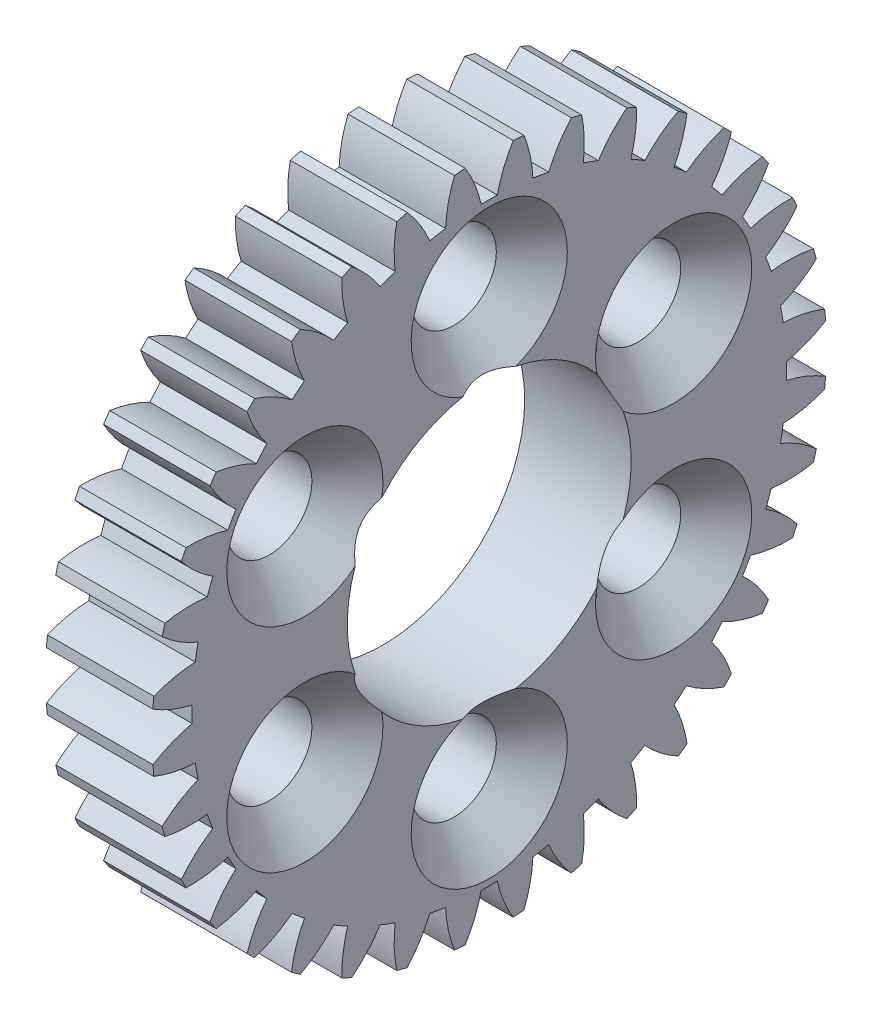
from build123d import *

# Parameters (mm, degrees)
BASPROSKE_W           = 3
BASPROSKE_H           = 9.5
TOOTHCUT_DEPTH        = 14.765899898
TEETHCUTS_COUNT       = 36
TEETHCUTS_ANGLE       = 350
BORSKE_R              = 4
BORE_DEPTH            = 50.0000508
PADR_OCIRCULAR1_COUNT = 6


with BuildPart() as part:
    # BasProSke → Base-Revolve (revolve)
    with BuildSketch(Plane(origin=(0, 0, 0), x_dir=(1, 0, 0), z_dir=(0, 1, 0))):
        with Locations((1.5, 4.75)):
            Rectangle(BASPROSKE_W, BASPROSKE_H)
    revolve(axis=Axis((-10, 0, 0), (1, 0, 0)))

    # TooCutSke → ToothCut (cut, through all)
    with BuildSketch(Plane(origin=(0, 0, 0), x_dir=(0, 0, -1), z_dir=(1, 0, 0))):
        with BuildLine():
            ThreePointArc((0.227221176, 8.370916708), (0, 8.374), (-0.227221176, 8.370916708))
            ThreePointArc((-0.227221176, 8.370916708), (-0.411410437, 8.955426484), (-0.69207336, 9.500225241))
            ThreePointArc((-0.69207336, 9.500225241), (0, 9.5254), (0.69207336, 9.500225241))
            ThreePointArc((0.69207336, 9.500225241), (0.411410437, 8.955426484), (0.227221176, 8.370916708))
        make_face()
    toothcut = extrude(amount=TOOTHCUT_DEPTH, mode=Mode.SUBTRACT)

    # TeethCuts: ToothCut ×36 about axis
    teethcuts_axis = Axis((-10, 0, 0), (1, 0, 0))
    for i in range(1, TEETHCUTS_COUNT):
        add(toothcut.rotate(teethcuts_axis, i * TEETHCUTS_ANGLE / (TEETHCUTS_COUNT - 1)), mode=Mode.SUBTRACT)

    # BorSke → Bore (cut, symmetric)
    with BuildSketch(Plane(origin=(0, 0, 0), x_dir=(0, 0, -1), z_dir=(1, 0, 0))):
        Circle(BORSKE_R)
    extrude(amount=BORE_DEPTH, both=True, mode=Mode.SUBTRACT)

    # Esboço2 → Escareado para parafuso com cabeça escareada chata de M21 (revolve, cut)
    with BuildSketch(Plane(origin=(3, 6, 0), x_dir=(0, 0, -1), z_dir=(0, 1, 0))):
        Polygon((0, 0), (0, 3.721032743), (1.2, 3), (1.2, 1), (2.2, 0), align=None)
    escareado_para_parafuso_com_cabe_a_escar = revolve(axis=Axis((9.35, 6, 0), (-1, 0, 0)), mode=Mode.SUBTRACT)

    # PadrãoCircular1: Escareado para parafuso com cabeça escareada chata de M21 ×6 about axis
    padr_ocircular1_axis = Axis((3, 0, 0), (1, 0, 0))
    for i in range(1, PADR_OCIRCULAR1_COUNT):
        add(escareado_para_parafuso_com_cabe_a_escar.rotate(padr_ocircular1_axis, i * 360 / PADR_OCIRCULAR1_COUNT), mode=Mode.SUBTRACT)


solid = part.part
